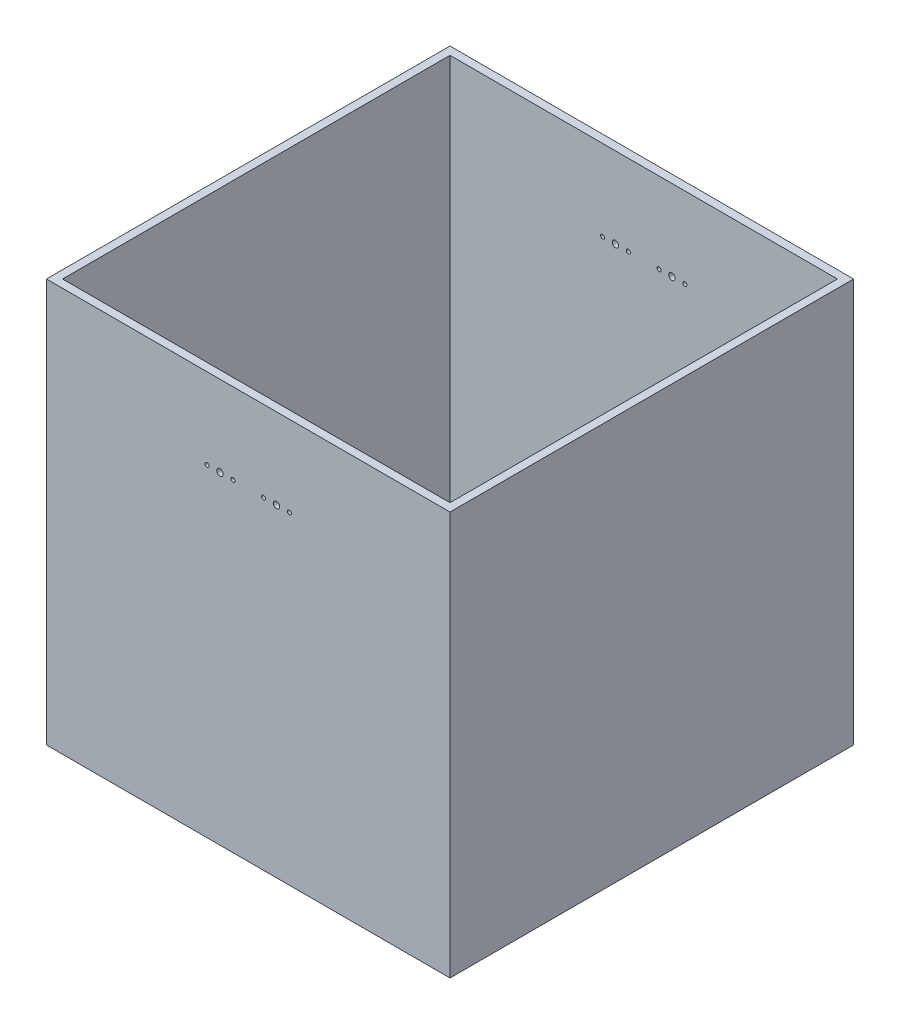
from build123d import *

# Parameters (mm, degrees)
SKETCH1_W               = 500
SKETCH1_H               = 500
SKETCH1_W_2             = 480
SKETCH1_H_2             = 480
BOSS_EXTRUDE1_DEPTH     = 500
CUT_EXTRUDE2_DEPTH      = 751
CUT_EXTRUDE2_DEPTH_BACK = 751
SKETCH4_R               = 4
SKETCH4_R_2             = 2.5


with BuildPart() as part:
    # Sketch1 → Boss-Extrude1 (new body)
    with BuildSketch(Plane(origin=(0, 0, 0), x_dir=(1, 0, 0), z_dir=(0, 1, 0))):
        Rectangle(SKETCH1_W, SKETCH1_H)
        Rectangle(SKETCH1_W_2, SKETCH1_H_2, mode=Mode.SUBTRACT)
    extrude(amount=BOSS_EXTRUDE1_DEPTH)

    # Sketch4 → Cut-Extrude2 (cut, two sides: drawn at the far end of the back side and taken through both)
    with BuildSketch(Plane(origin=(0, 0, -250), x_dir=(-1, 0, 0), z_dir=(0, 0, -1)).offset(-CUT_EXTRUDE2_DEPTH_BACK)):
        with Locations((35, 400)):
            Circle(SKETCH4_R)
        with Locations((-35, 400)):
            Circle(SKETCH4_R)
        with Locations((-19, 400)):
            Circle(SKETCH4_R_2)
        with Locations((-51, 400)):
            Circle(SKETCH4_R_2)
        with Locations((19, 400)):
            Circle(SKETCH4_R_2)
        with Locations((51, 400)):
            Circle(SKETCH4_R_2)
    extrude(amount=CUT_EXTRUDE2_DEPTH + CUT_EXTRUDE2_DEPTH_BACK, mode=Mode.SUBTRACT)


solid = part.part
